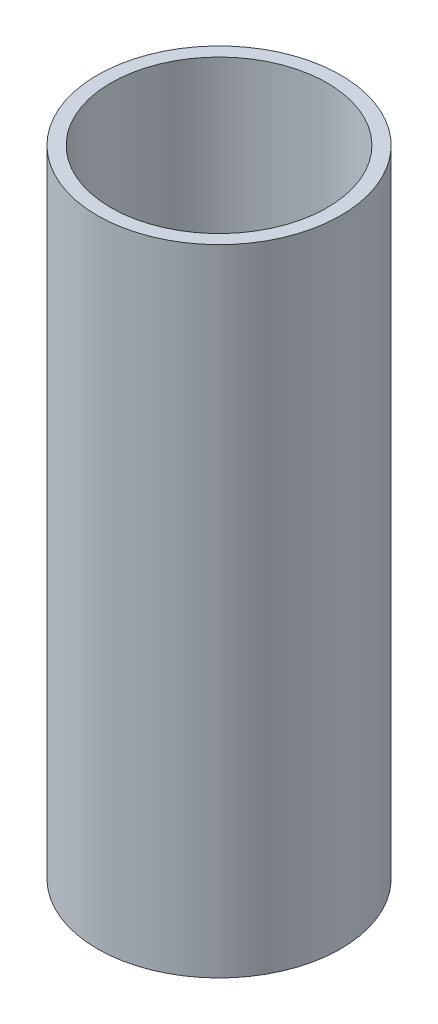
from build123d import *

# Parameters (mm, degrees)
SKETCH1_R           = 42.5
BOSS_EXTRUDE1_DEPTH = 221.795816501
SKETCH2_R           = 37.757536013
CUT_EXTRUDE1_DEPTH  = 230.795309389


with BuildPart() as part:
    # Sketch1 → Boss-Extrude1 (new body)
    with BuildSketch(Plane(origin=(0, 0, 0), x_dir=(1, 0, 0), z_dir=(0, 1, 0))):
        Circle(SKETCH1_R)
    extrude(amount=BOSS_EXTRUDE1_DEPTH)

    # Sketch2 → Cut-Extrude1 (cut, through all)
    with BuildSketch(Plane(origin=(0, 0, 0), x_dir=(1, 0, 0), z_dir=(0, 1, 0))):
        Circle(SKETCH2_R)
    extrude(amount=CUT_EXTRUDE1_DEPTH, mode=Mode.SUBTRACT)


solid = part.part
